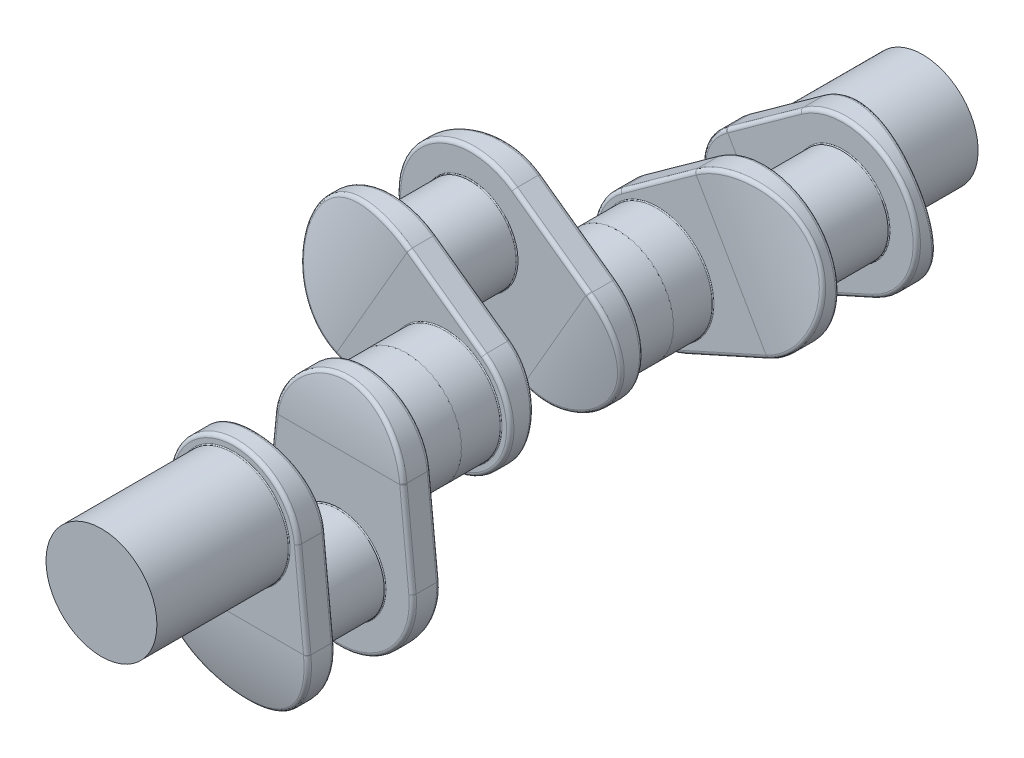
from build123d import *

# Parameters (mm, degrees)
SKETCH1_R               = 38.1
BOSS_EXTRUDE1_DEPTH     = 27.31
BOSS_EXTRUDE2_DEPTH     = 19
SKETCH3_R               = 31.75
BOSS_EXTRUDE3_DEPTH     = 26.67
CUT_EXTRUDE1_DEPTH      = 134.157346399
CUT_EXTRUDE1_DEPTH_BACK = 134.157346399
FILLET1_R               = 0.64
FILLET2_R               = 2.54
LPATTERN1_COUNT         = 3
LPATTERN1_PITCH         = 145.62
BODY_MOVE_COPY1_ANGLE   = 120
BODY_MOVE_COPY2_ANGLE   = 120
SKETCH5_R               = 38.1
BOSS_EXTRUDE4_DEPTH     = 63.5
SKETCH6_R               = 38.1
BOSS_EXTRUDE5_DEPTH     = 63.5


with BuildPart() as part:
    # Sketch1 → Boss-Extrude1 (new body)
    with BuildSketch(Plane.XY):
        Circle(SKETCH1_R)
    extrude(amount=BOSS_EXTRUDE1_DEPTH)

    # Sketch2 → Boss-Extrude2 (add)
    with BuildSketch(Plane(origin=(0, 0, 0), x_dir=(-1, 0, 0), z_dir=(0, 0, -1))):
        with BuildLine():
            Line((44.227191579, 4.445), (50.545361805, -58.42))
            ThreePointArc((50.545361805, -58.42), (0, -114.3), (-50.545361805, -58.42))
            Line((-50.545361805, -58.42), (-44.227191579, 4.445))
            ThreePointArc((-44.227191579, 4.445), (0, 44.45), (44.227191579, 4.445))
        make_face()
    extrude(amount=BOSS_EXTRUDE2_DEPTH)

    # Sketch3 → Boss-Extrude3 (add)
    with BuildSketch(Plane(origin=(0, 0, -19), x_dir=(-1, 0, 0), z_dir=(0, 0, -1))):
        with Locations((0, -63.5)):
            Circle(SKETCH3_R)
    extrude(amount=BOSS_EXTRUDE3_DEPTH)

    # Sketch4 → Cut-Extrude1 (cut, two sides: drawn at the far end of the back side and taken through both)
    with BuildSketch(Plane(origin=(0, 0, 0), x_dir=(0, 0, -1), z_dir=(1, 0, 0)).offset(-CUT_EXTRUDE1_DEPTH_BACK)):
        with BuildLine():
            Line((14, 44.45), (19, 44.45))
            Line((19, 44.45), (19, 3.645588474))
            ThreePointArc((19, 3.645588474), (17.745342707, 24.200393265), (14, 44.45))
        make_face()
        with BuildLine():
            Line((0, -58.436326651), (0, -114.3))
            Line((0, -114.3), (9.5, -114.3))
            ThreePointArc((9.5, -114.3), (2.391926966, -86.769169784), (0, -58.436326651))
        make_face()
    extrude(amount=CUT_EXTRUDE1_DEPTH + CUT_EXTRUDE1_DEPTH_BACK, mode=Mode.SUBTRACT)

    # Fillet1
    fillet1_edges = [part.edges().sort_by_distance(p)[0] for p in [
        (-38.1, 0, 0),
        (31.75, -63.5, -19),
    ]]
    fillet(fillet1_edges, radius=FILLET1_R)

    # Fillet2
    fillet2_edges = [part.edges().sort_by_distance(p)[0] for p in [
        (44.267363409, 4.045295344, -18.99952732),
        (47.426448633, -27.387205763, -19),
        (0, -114.3, -19),
        (-47.426448633, -27.387205763, -19),
        (-44.267363409, 4.045295344, -18.99952732),
        (-47.386276692, -26.9875, 0),
        (-50.546181578, -58.42816326, 0),
        (0, -114.3, -9.5),
        (50.546181578, -58.42816326, 0),
        (47.386276692, -26.9875, 0),
        (29.820825818, 32.962415678, -16.437747036),
        (0, 44.45, 0),
    ]]
    fillet(fillet2_edges, radius=FILLET2_R)

    # Mirror1: part across plane


with BuildPart() as part_1:
    add(part.part)
    add(part.part.mirror(Plane(origin=(0, -63.5, -45.67), x_dir=(1, 0, 0), z_dir=(0, 0, -1))))


with BuildPart() as lpattern1_1:
    # LPattern1: pattern copy
    add(part_1.part.moved(Location(Vector(0, 0, -1) * (1 * LPATTERN1_PITCH))))


with BuildPart() as lpattern1_2:
    # LPattern1: pattern copy
    add(part_1.part.moved(Location(Vector(0, 0, -1) * (2 * LPATTERN1_PITCH))))


with BuildPart() as lpattern1_1_1:
    # Body-Move/Copy1: moved
    add(lpattern1_1.part.rotate(Axis((0, 0, 0), (0, 0, -1)), BODY_MOVE_COPY1_ANGLE))


with BuildPart() as lpattern1_2_1:
    # Body-Move/Copy2: moved
    add(lpattern1_2.part.rotate(Axis((0, 0, 0), (0, 0, 1)), BODY_MOVE_COPY2_ANGLE))

    # Sketch5 → Boss-Extrude4 (add)
    with BuildSketch(Plane(origin=(0, 0, -409.89), x_dir=(-1, 0, 0), z_dir=(0, 0, -1))):
        Circle(SKETCH5_R)
    extrude(amount=BOSS_EXTRUDE4_DEPTH)


with BuildPart() as part_2:
    add(part_1.part)

    # Sketch6 → Boss-Extrude5 (add)
    with BuildSketch(Plane.XY.offset(27.31)):
        Circle(SKETCH6_R)
    extrude(amount=BOSS_EXTRUDE5_DEPTH)


solid = Compound([lpattern1_1_1.part, lpattern1_2_1.part, part_2.part])
